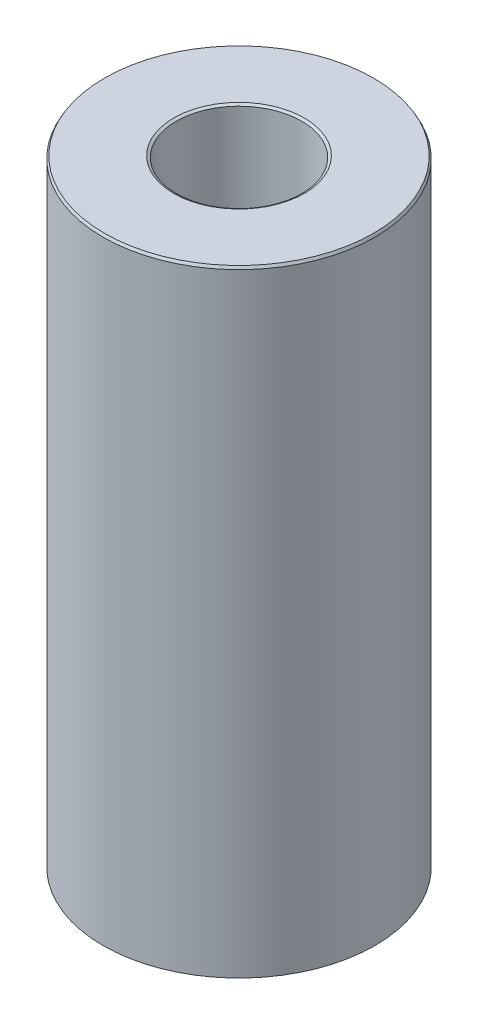
from build123d import *
from OCP.BRepFilletAPI import BRepFilletAPI_MakeChamfer

# Parameters (mm, degrees)
SKETCH1_R           = 55
BOSS_EXTRUDE1_DEPTH = 249.802985194
SKETCH2_R           = 25.387342644
CUT_EXTRUDE1_DEPTH  = 262.632435703
CHAMFER1_SIZE       = 1.037940929
CHAMFER1_SIZE2      = 0.599255474


with BuildPart() as part:
    # Sketch1 → Boss-Extrude1 (new body)
    with BuildSketch(Plane(origin=(0, 0, 0), x_dir=(1, 0, 0), z_dir=(0, 1, 0))):
        Circle(SKETCH1_R)
    extrude(amount=BOSS_EXTRUDE1_DEPTH)

    # Sketch2 → Cut-Extrude1 (cut, through all)
    with BuildSketch(Plane(origin=(0, 0, 0), x_dir=(1, 0, 0), z_dir=(0, 1, 0))):
        Circle(SKETCH2_R)
    extrude(amount=CUT_EXTRUDE1_DEPTH, mode=Mode.SUBTRACT)

    # Chamfer1: one chamfer whose edges measure the first distance from different faces: ONE call of the kernel's chamfer builder (chamfer() names one face for all edges)
    chamfer1_edges_1 = [part.edges().sort_by_distance(p)[0] for p in [
        (-25.387342644, 249.802985194, 0),
    ]]
    chamfer1_side_1 = [part.faces().sort_by_distance(p)[0] for p in [
        (-53.444365081, 249.802985194, 0),
    ]]
    chamfer1_edges_2 = [part.edges().sort_by_distance(p)[0] for p in [
        (-25.387342644, 0, 0),
    ]]
    chamfer1_side_2 = [part.faces().sort_by_distance(p)[0] for p in [
        (-25.387342644, 124.901492597, 0),
    ]]
    chamfer1_edges_3 = [part.edges().sort_by_distance(p)[0] for p in [
        (-55, 0, 0),
    ]]
    chamfer1_side_3 = [part.faces().sort_by_distance(p)[0] for p in [
        (-53.444365081, 0, 0),
    ]]
    chamfer1_edges_4 = [part.edges().sort_by_distance(p)[0] for p in [
        (-55, 249.802985194, 0),
    ]]
    chamfer1_side_4 = [part.faces().sort_by_distance(p)[0] for p in [
        (-55, 124.901492597, 0),
    ]]
    chamfer1 = BRepFilletAPI_MakeChamfer(part.part.solid().wrapped)
    for e in chamfer1_edges_1:
        chamfer1.Add(CHAMFER1_SIZE, CHAMFER1_SIZE2, e.wrapped, chamfer1_side_1[0].wrapped)  # the first distance lies on this face
    for e in chamfer1_edges_2:
        chamfer1.Add(CHAMFER1_SIZE, CHAMFER1_SIZE2, e.wrapped, chamfer1_side_2[0].wrapped)  # the first distance lies on this face
    for e in chamfer1_edges_3:
        chamfer1.Add(CHAMFER1_SIZE, CHAMFER1_SIZE2, e.wrapped, chamfer1_side_3[0].wrapped)  # the first distance lies on this face
    for e in chamfer1_edges_4:
        chamfer1.Add(CHAMFER1_SIZE, CHAMFER1_SIZE2, e.wrapped, chamfer1_side_4[0].wrapped)  # the first distance lies on this face
    add(Compound.cast(chamfer1.Shape()), mode=Mode.REPLACE)


solid = part.part
